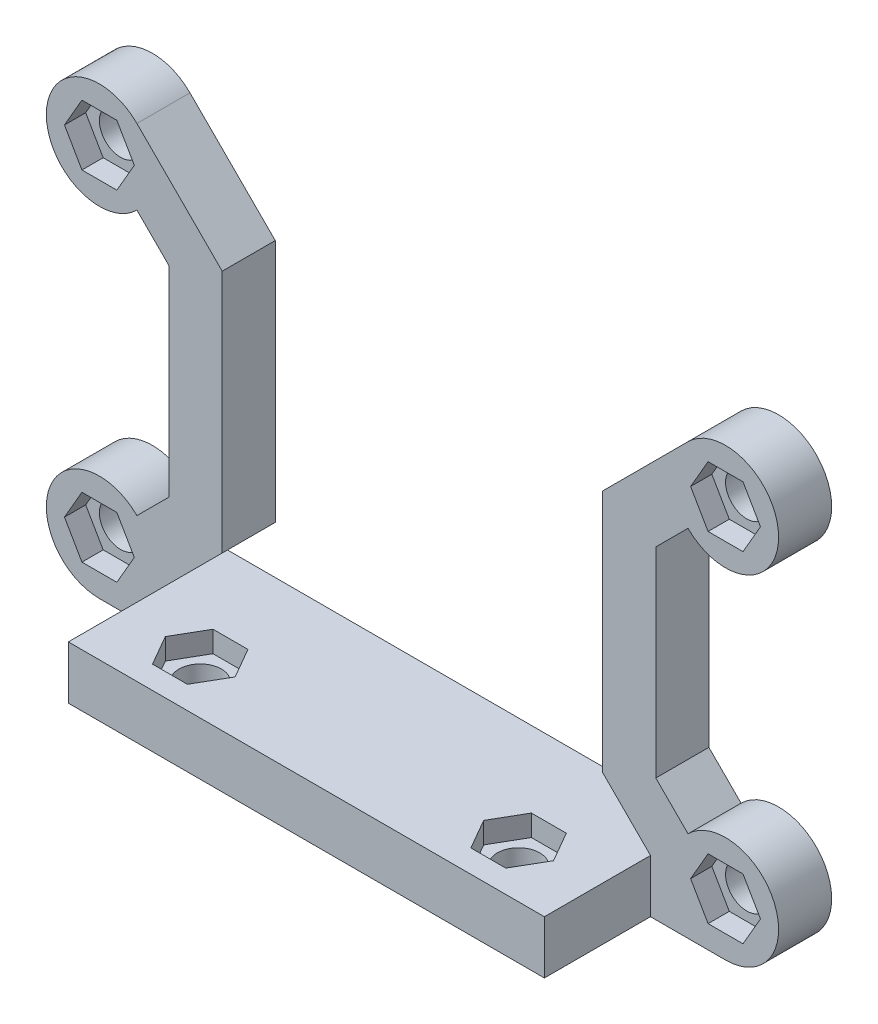
from build123d import *

# Parameters (mm, degrees)
ESQUISSE1_R             = 2
BOSS_EXTRU_1_DEPTH      = 5
ESQUISSE2_R             = 2
BOSS_EXTRU_2_DEPTH      = 5
ENL_V_MAT_EXTRU_1_DEPTH = 2
ENL_V_MAT_EXTRU_2_DEPTH = 2


with BuildPart() as part:
    # Esquisse1 → Boss.-Extru.1 (new body)
    with BuildSketch(Plane.XY):
        with BuildLine():
            Line((3.535533906, 28.464466094), (6.571067812, 25.428932188))
            Line((6.571067812, 25.428932188), (6.571067812, 6.571067812))
            Line((6.571067812, 6.571067812), (3.535533906, 3.535533906))
            ThreePointArc((3.535533906, 3.535533906), (-4.619397663, 1.913417162), (0, -5))
            Line((0, -5), (59, -5))
            ThreePointArc((59, -5), (63.619397663, 1.913417162), (55.464466094, 3.535533906))
            Line((55.464466094, 3.535533906), (52.428932188, 6.571067812))
            Line((52.428932188, 6.571067812), (52.428932188, 25.428932188))
            Line((52.428932188, 25.428932188), (55.464466094, 28.464466094))
            ThreePointArc((55.464466094, 28.464466094), (64, 32), (55.464466094, 35.535533906))
            Line((55.464466094, 35.535533906), (47.428932188, 27.5))
            Line((47.428932188, 27.5), (47.428932188, 4.5))
            Line((47.428932188, 4.5), (51.928932188, 0))
            Line((51.928932188, 0), (7.071067812, 0))
            Line((7.071067812, 0), (11.571067812, 4.5))
            Line((11.571067812, 4.5), (11.571067812, 27.5))
            Line((11.571067812, 27.5), (3.535533906, 35.535533906))
            ThreePointArc((3.535533906, 35.535533906), (-5, 32), (3.535533906, 28.464466094))
        make_face()
        Circle(ESQUISSE1_R, mode=Mode.SUBTRACT)
        with Locations((0, 32)):
            Circle(ESQUISSE1_R, mode=Mode.SUBTRACT)
        with Locations((59, 32)):
            Circle(ESQUISSE1_R, mode=Mode.SUBTRACT)
        with Locations((59, 0)):
            Circle(ESQUISSE1_R, mode=Mode.SUBTRACT)
    extrude(amount=BOSS_EXTRU_1_DEPTH)

    # Esquisse2 → Boss.-Extru.2 (add)
    with BuildSketch(Plane.XZ.offset(5)):
        Polygon((9.5, 5), (49.5, 5), (51.928932188, 5), (51.928932188, 15), (49.5, 15), (9.5, 15), (7.071067812, 15), (7.071067812, 5), align=None)
        with Locations((14.5, 10)):
            Circle(ESQUISSE2_R, mode=Mode.SUBTRACT)
        with Locations((44.5, 10)):
            Circle(ESQUISSE2_R, mode=Mode.SUBTRACT)
    extrude(amount=-BOSS_EXTRU_2_DEPTH)

    # Esquisse3 → Enlèv. mat.-Extru.1 (cut)
    with BuildSketch(Plane(origin=(0, 0, 0), x_dir=(1, 0, 0), z_dir=(0, 1, 0))):
        Polygon((46.145448267, -7.15), (42.854551733, -7.15), (41.209103466, -10), (42.854551733, -12.85), (46.145448267, -12.85), (47.790896534, -10), align=None)
        Polygon((16.145448267, -7.15), (12.854551733, -7.15), (11.209103466, -10), (12.854551733, -12.85), (16.145448267, -12.85), (17.790896534, -10), align=None)
    extrude(amount=-ENL_V_MAT_EXTRU_1_DEPTH, mode=Mode.SUBTRACT)

    # Esquisse4 → Enlèv. mat.-Extru.2 (cut)
    with BuildSketch(Plane.XY.offset(5)):
        Polygon((1.645448267, 34.85), (-1.645448267, 34.85), (-3.290896534, 32), (-1.645448267, 29.15), (1.645448267, 29.15), (3.290896534, 32), align=None)
        Polygon((60.645448267, 34.85), (57.354551733, 34.85), (55.709103466, 32), (57.354551733, 29.15), (60.645448267, 29.15), (62.290896534, 32), align=None)
        Polygon((60.645448267, 2.85), (57.354551733, 2.85), (55.709103466, 0), (57.354551733, -2.85), (60.645448267, -2.85), (62.290896534, 0), align=None)
        Polygon((1.645448267, 2.85), (-1.645448267, 2.85), (-3.290896534, 0), (-1.645448267, -2.85), (1.645448267, -2.85), (3.290896534, 0), align=None)
    extrude(amount=-ENL_V_MAT_EXTRU_2_DEPTH, mode=Mode.SUBTRACT)


solid = part.part
